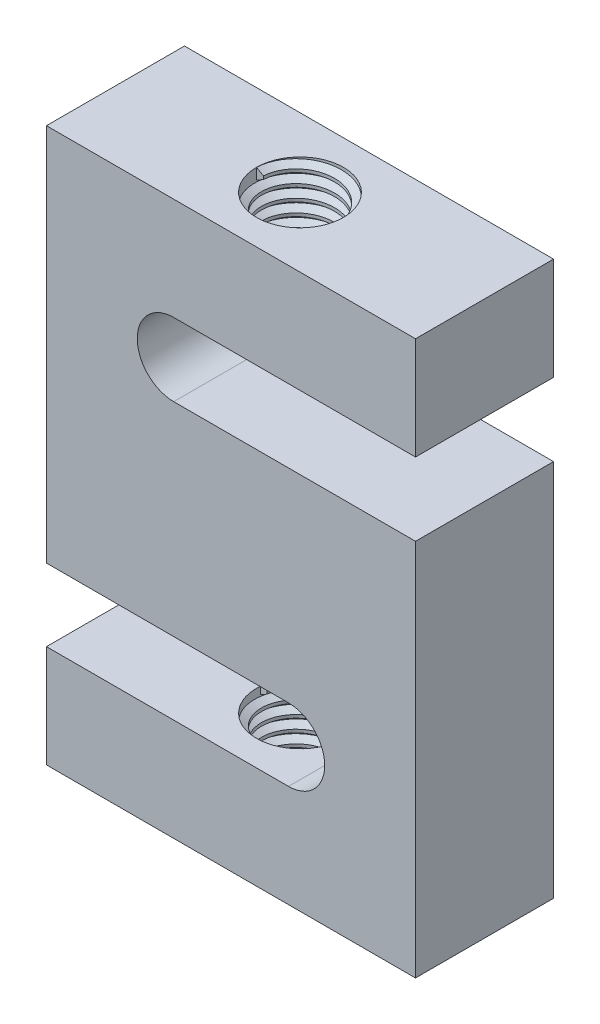
from build123d import *
from build123d.topology import SkipClean

# Parameters (mm, degrees)
BOSS_EXTRUDE1_DEPTH = 19
SKETCH6_R           = 5.98
CUT_EXTRUDE1_DEPTH  = 14.1
THREAD1_PITCH       = 1.75
CUT_EXTRUDE2_START  = -14.1
SKETCH11_R          = 5.98
CUT_EXTRUDE2_DEPTH  = 14.1
THREAD2_PITCH       = 1.75


with BuildPart() as part:
    # Sketch1 → Boss-Extrude1 (new body)
    with BuildSketch(Plane.XY):
        with BuildLine():
            Line((25.4, 13.96), (25.4, -14.04))
            Line((25.4, -14.04), (25.4, -38.1))
            Line((25.4, -38.1), (-25.4, -38.1))
            Line((-25.4, -38.1), (-25.4, -24))
            Line((-25.4, -24), (7.92, -24))
            ThreePointArc((7.92, -24), (12.9, -19.02), (7.92, -14.04))
            Line((7.92, -14.04), (-25.4, -14.04))
            Line((-25.4, -14.04), (-25.4, 38.1))
            Line((-25.4, 38.1), (25.4, 38.1))
            Line((25.4, 38.1), (25.4, 24))
            Line((25.4, 24), (-7.88, 24))
            ThreePointArc((-7.88, 24), (-12.9, 18.98), (-7.88, 13.96))
            Line((-7.88, 13.96), (25.4, 13.96))
        make_face()
    extrude(amount=BOSS_EXTRUDE1_DEPTH)

    # Sketch6 → Cut-Extrude1 (cut)
    with BuildSketch(Plane(origin=(0, 38.1, 0), x_dir=(1, 0, 0), z_dir=(0, 1, 0))):
        with Locations(Location((0, -9.5, 0), (0, 0, 270))):
            Circle(SKETCH6_R)
    extrude(amount=-CUT_EXTRUDE1_DEPTH, mode=Mode.SUBTRACT)

    # Thread1: arcs per turn and ends read off the stored shape
    # Thread1: the profile of Thread Profile1 profile screwed along a right-hand helix through 7.485714 turns, 10 arcs to a turn; built about Z, then put on its axis
    with SkipClean():  # the faces are left unmerged after this step: merging them gives an invalid solid
        thread1_z = Axis((0, 0, 0), (0, 0, 1))
        thread1_corners = [(5.9803, 0, -0.000173205), (5.9803, 0, 1.5314232), (5.032784719, 0, 0.984374998), (5.032784719, 0, 0.546874998)]
        with BuildLine(mode=Mode.PRIVATE) as thread1_profile:
            Line(thread1_corners[0], thread1_corners[1])
            Line(thread1_corners[1], thread1_corners[2])
            Line(thread1_corners[2], thread1_corners[3])
            Line(thread1_corners[3], thread1_corners[0])
        thread1_cap = Face(thread1_profile.wire())
        thread1_turn_angles = [0, 18, 36, 54, 72, 90, 108, 126, 144, 162, 180, 198, 216, 234, 252, 270, 288, 306, 324, 342, 360]
        thread1_turn_weights = [1, 0.9510565162951535, 1, 0.9510565162951535, 1, 0.9510565162951535, 1, 0.9510565162951535, 1, 0.9510565162951535, 1, 0.9510565162951535, 1, 0.9510565162951535, 1, 0.9510565162951535, 1, 0.9510565162951535, 1, 0.9510565162951535, 1]
        thread1_turn_rails = [Edge.make_bspline([Vector(p[0], p[1], 0).rotate(thread1_z, thread1_turn_angles[k]) / thread1_turn_weights[k] + Vector(0, 0, p[2] + THREAD1_PITCH * thread1_turn_angles[k] / 360) for k in range(21)], [0, 0, 0, 1, 1, 2, 2, 3, 3, 4, 4, 5, 5, 6, 6, 7, 7, 8, 8, 9, 9, 10, 10, 10], 2, thread1_turn_weights) for p in thread1_corners]
        thread1_turn_sides = [Face.make_surface_from_curves(thread1_turn_rails[p[0]], thread1_turn_rails[p[1]]) for p in [(0, 1), (1, 2), (2, 3), (3, 0)]]
        thread1_last_angles = [2520, 2538, 2556, 2574, 2592, 2610, 2628, 2646, 2664, 2679.4285, 2694.857]
        thread1_last_weights = [1, 0.9510565162951535, 1, 0.9510565162951535, 1, 0.9510565162951535, 1, 0.9510565162951535, 1, 0.9639631923535962, 1]
        thread1_last_rails = [Edge.make_bspline([Vector(p[0], p[1], 0).rotate(thread1_z, thread1_last_angles[k]) / thread1_last_weights[k] + Vector(0, 0, p[2] + THREAD1_PITCH * thread1_last_angles[k] / 360) for k in range(11)], [0, 0, 0, 1, 1, 2, 2, 3, 3, 4, 4, 5, 5, 5], 2, thread1_last_weights) for p in thread1_corners]
        thread1_last_sides = [Face.make_surface_from_curves(thread1_last_rails[p[0]], thread1_last_rails[p[1]]) for p in [(0, 1), (1, 2), (2, 3), (3, 0)]]
        thread1 = Plane(origin=(0, 38.1, 9.5), x_dir=(-1, 0, 0), z_dir=(0, -1, 0)) * Solid(Shell([*[p.moved(Location((0, 0, THREAD1_PITCH * i))) for i in range(7) for p in thread1_turn_sides], *thread1_last_sides, thread1_cap, thread1_cap.rotate(thread1_z, 2694.857).moved(Location((0, 0, THREAD1_PITCH * 2694.857 / 360)))]))
        add(thread1)

    # Sketch11 → Cut-Extrude2 (cut)
    with SkipClean():  # the faces are left unmerged after this step: merging them gives an invalid solid
        with BuildSketch(Plane.XZ.offset(38.1).offset(CUT_EXTRUDE2_START)):
            with Locations(Location((0, 9.5, 0), (0, 0, 270))):
                Circle(SKETCH11_R)
        extrude(amount=CUT_EXTRUDE2_DEPTH, mode=Mode.SUBTRACT)

    # Thread2: arcs per turn and ends read off the stored shape
    # Thread2: the profile of Thread Profile2 profile screwed along a right-hand helix through 7.485714 turns, 10 arcs to a turn; built about Z, then put on its axis
    with SkipClean():  # the faces are left unmerged after this step: merging them gives an invalid solid
        thread2_z = Axis((0, 0, 0), (0, 0, 1))
        thread2_corners = [(5.9803, 0, -0.000173205), (5.9803, 0, 1.5314232), (5.032784719, 0, 0.984374998), (5.032784719, 0, 0.546874998)]
        with BuildLine(mode=Mode.PRIVATE) as thread2_profile:
            Line(thread2_corners[0], thread2_corners[1])
            Line(thread2_corners[1], thread2_corners[2])
            Line(thread2_corners[2], thread2_corners[3])
            Line(thread2_corners[3], thread2_corners[0])
        thread2_cap = Face(thread2_profile.wire())
        thread2_turn_angles = [0, 18, 36, 54, 72, 90, 108, 126, 144, 162, 180, 198, 216, 234, 252, 270, 288, 306, 324, 342, 360]
        thread2_turn_weights = [1, 0.9510565162951535, 1, 0.9510565162951535, 1, 0.9510565162951535, 1, 0.9510565162951535, 1, 0.9510565162951535, 1, 0.9510565162951535, 1, 0.9510565162951535, 1, 0.9510565162951535, 1, 0.9510565162951535, 1, 0.9510565162951535, 1]
        thread2_turn_rails = [Edge.make_bspline([Vector(p[0], p[1], 0).rotate(thread2_z, thread2_turn_angles[k]) / thread2_turn_weights[k] + Vector(0, 0, p[2] + THREAD2_PITCH * thread2_turn_angles[k] / 360) for k in range(21)], [0, 0, 0, 1, 1, 2, 2, 3, 3, 4, 4, 5, 5, 6, 6, 7, 7, 8, 8, 9, 9, 10, 10, 10], 2, thread2_turn_weights) for p in thread2_corners]
        thread2_turn_sides = [Face.make_surface_from_curves(thread2_turn_rails[p[0]], thread2_turn_rails[p[1]]) for p in [(0, 1), (1, 2), (2, 3), (3, 0)]]
        thread2_last_angles = [2520, 2538, 2556, 2574, 2592, 2610, 2628, 2646, 2664, 2679.4285, 2694.857]
        thread2_last_weights = [1, 0.9510565162951535, 1, 0.9510565162951535, 1, 0.9510565162951535, 1, 0.9510565162951535, 1, 0.9639631923535962, 1]
        thread2_last_rails = [Edge.make_bspline([Vector(p[0], p[1], 0).rotate(thread2_z, thread2_last_angles[k]) / thread2_last_weights[k] + Vector(0, 0, p[2] + THREAD2_PITCH * thread2_last_angles[k] / 360) for k in range(11)], [0, 0, 0, 1, 1, 2, 2, 3, 3, 4, 4, 5, 5, 5], 2, thread2_last_weights) for p in thread2_corners]
        thread2_last_sides = [Face.make_surface_from_curves(thread2_last_rails[p[0]], thread2_last_rails[p[1]]) for p in [(0, 1), (1, 2), (2, 3), (3, 0)]]
        thread2 = Plane(origin=(0, -38.1, 9.5), x_dir=(1, 0, 0), z_dir=(0, 1, 0)) * Solid(Shell([*[p.moved(Location((0, 0, THREAD2_PITCH * i))) for i in range(7) for p in thread2_turn_sides], *thread2_last_sides, thread2_cap, thread2_cap.rotate(thread2_z, 2694.857).moved(Location((0, 0, THREAD2_PITCH * 2694.857 / 360)))]))
        add(thread2)


solid = part.part
